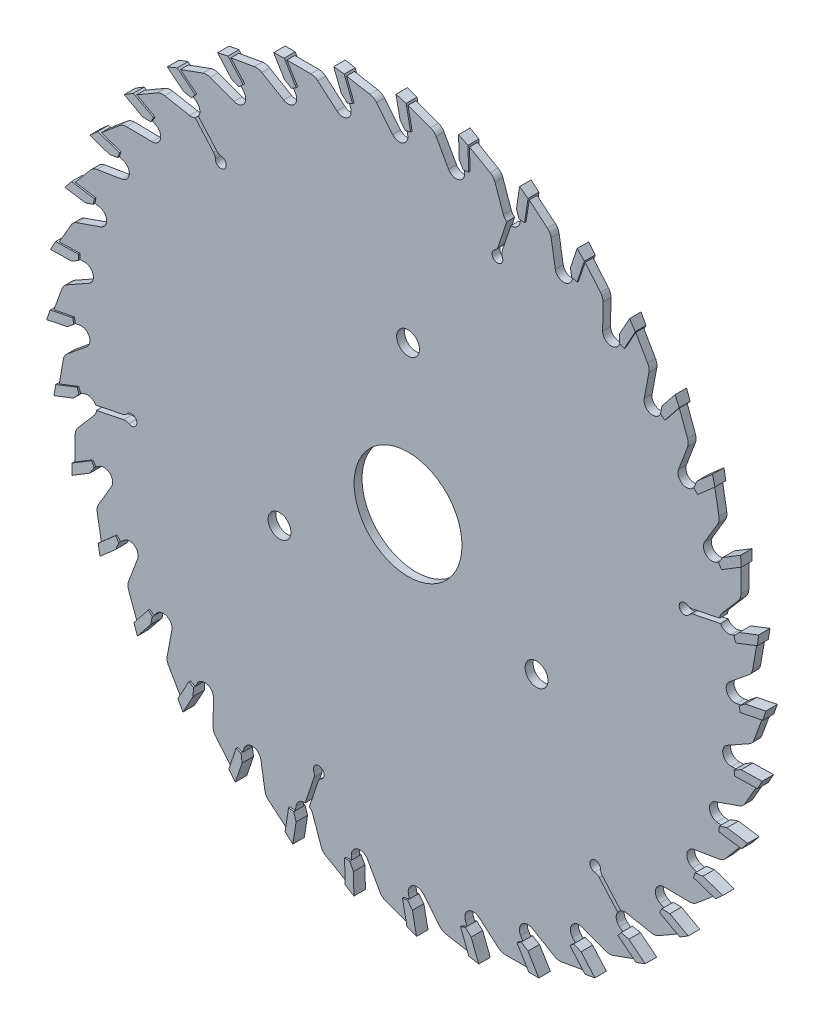
from build123d import *

# Parameters (mm, degrees)
SZKIC1_R                    = 98.5
SZKIC1_R_2                  = 15
DODANIE_WYCI_GNI_CIE1_DEPTH = 1.1
WYTNIJ_WYCI_GNI_CIE1_DEPTH  = 140.317407383
WYTNIJ_WYCI_GNI_CIE2_DEPTH  = 140.317407383
SZYK_KO_OWY2_COUNT          = 36
WYTNIJ_WYCI_GNI_CIE3_DEPTH  = 140.317407383
WYTNIJ_WYCI_GNI_CIE4_DEPTH  = 140.317407383
DODANIE_WYCI_GNI_CIE2_DEPTH = 1.6
WYTNIJ_WYCI_GNI_CIE6_DEPTH  = 15
SZYK_KO_OWY3_COUNT          = 36
WYTNIJ_WYCI_GNI_CIE5_DEPTH  = 142.447127931
SZYK_KO_OWY4_COUNT          = 6
CUT_EXTRUDE1_REACH          = 143.447
SKETCH1_R                   = 3.175


with BuildPart() as part:
    # Szkic1 → Dodanie-wyciągnięcie1 (new, symmetric)
    with BuildSketch(Plane.XY):
        Circle(SZKIC1_R)
        Circle(SZKIC1_R_2, mode=Mode.SUBTRACT)
    extrude(amount=DODANIE_WYCI_GNI_CIE1_DEPTH, both=True)

    # Szkic2 → Wytnij-wyciągnięcie1 (cut, through all)
    with BuildSketch(Plane.XY.offset(1.1)):
        with BuildLine():
            Line((0, 98.5), (1.136487637, 92.81243498))
            Line((1.136487637, 92.81243498), (-0.334434351, 92.518515764))
            Line((-0.334434351, 92.518515764), (-1.527286709, 98.488158655))
            ThreePointArc((-1.527286709, 98.488158655), (-0.763666306, 98.497039619), (0, 98.5))
        make_face()
    wytnij_wyci_gni_cie1 = extrude(amount=-WYTNIJ_WYCI_GNI_CIE1_DEPTH, mode=Mode.SUBTRACT)

    # Szkic3 → Wytnij-wyciągnięcie2 (cut, through all)
    with BuildSketch(Plane.XY.offset(1.1)):
        with BuildLine():
            Line((-1.527286709, 98.488158655), (-0.098383681, 91.337197557))
            ThreePointArc((-0.098383681, 91.337197557), (-1.426199989, 88.697128692), (-4.309075365, 89.346812717))
            Line((-4.309075365, 89.346812717), (-11.271301282, 97.85299059))
            ThreePointArc((-11.271301282, 97.85299059), (-6.407169676, 98.291394215), (-1.527286709, 98.488158655))
        make_face()
    wytnij_wyci_gni_cie2 = extrude(amount=-WYTNIJ_WYCI_GNI_CIE2_DEPTH, mode=Mode.SUBTRACT)

    # Szyk kołowy2: Wytnij-wyciągnięcie1, Wytnij-wyciągnięcie2 ×36 about axis
    szyk_ko_owy2_axis = Axis((0, 0, 14.502445444), (0, 0, -1))
    add([wytnij_wyci_gni_cie1.rotate(szyk_ko_owy2_axis, i * 360 / SZYK_KO_OWY2_COUNT) for i in range(1, SZYK_KO_OWY2_COUNT)], mode=Mode.SUBTRACT)
    add([wytnij_wyci_gni_cie2.rotate(szyk_ko_owy2_axis, i * 360 / SZYK_KO_OWY2_COUNT) for i in range(1, SZYK_KO_OWY2_COUNT)], mode=Mode.SUBTRACT)

    # Szkic4 → Wytnij-wyciągnięcie3 (cut, through all)
    with BuildSketch(Plane.XY.offset(1.1)):
        Polygon((-17.1043455, 97.003563672), (-11.399402036, 98.009499128), (-9.474966457, 95.6582983), align=None)
    wytnij_wyci_gni_cie3 = extrude(amount=-WYTNIJ_WYCI_GNI_CIE3_DEPTH, mode=Mode.SUBTRACT)

    # Szkic5 → Wytnij-wyciągnięcie4 (cut, through all)
    with BuildSketch(Plane.XY.offset(1.1)):
        with BuildLine():
            Line((-10.570772762, 95.851518518), (-9.474966457, 95.6582983))
            Line((-9.474966457, 95.6582983), (-8.770196666, 94.797237876))
            ThreePointArc((-8.770196666, 94.797237876), (-9.575874636, 95.485960074), (-10.570772762, 95.851518518))
        make_face()
    wytnij_wyci_gni_cie4 = extrude(amount=-WYTNIJ_WYCI_GNI_CIE4_DEPTH, mode=Mode.SUBTRACT)

    # Szkic7 → Dodanie-wyciągnięcie2 (add, symmetric)
    with BuildSketch(Plane.XY):
        Polygon((-0.118562575, 99.093347724), (1.136487637, 92.81243498), (-0.334434351, 92.518515764), (-1.706941298, 94.283798937), (-2.849150981, 100), align=None)
    dodanie_wyci_gni_cie2 = extrude(amount=DODANIE_WYCI_GNI_CIE2_DEPTH, both=True)

    # Szkic9 → Wytnij-wyciągnięcie6 (cut)
    with BuildSketch(Plane(origin=(-17.790057004, 89.030538173, 0), x_dir=(0.980614658546611, 0.19594614424252776, 0), z_dir=(0.19594614424252776, -0.980614658546611, 0))):
        Polygon((16.800695208, 1.6), (19.300695208, 1.512698076), (19.300695208, 1.6), align=None)
        Polygon((16.800695208, -1.6), (19.300695208, -1.6), (19.300695208, -1.512698076), align=None)
    wytnij_wyci_gni_cie6 = extrude(amount=-WYTNIJ_WYCI_GNI_CIE6_DEPTH, mode=Mode.SUBTRACT)

    # Szyk kołowy3: Wytnij-wyciągnięcie3, Wytnij-wyciągnięcie4, Dodanie-wyciągnięcie2, Wytnij-wyciągnięcie6 ×36 about axis
    szyk_ko_owy3_axis = Axis((0, 0, 14.502445444), (0, 0, -1))
    add([wytnij_wyci_gni_cie3.rotate(szyk_ko_owy3_axis, i * 360 / SZYK_KO_OWY3_COUNT) for i in range(1, SZYK_KO_OWY3_COUNT)], mode=Mode.SUBTRACT)
    add([wytnij_wyci_gni_cie4.rotate(szyk_ko_owy3_axis, i * 360 / SZYK_KO_OWY3_COUNT) for i in range(1, SZYK_KO_OWY3_COUNT)], mode=Mode.SUBTRACT)
    add([dodanie_wyci_gni_cie2.rotate(szyk_ko_owy3_axis, i * 360 / SZYK_KO_OWY3_COUNT) for i in range(1, SZYK_KO_OWY3_COUNT)])
    add([wytnij_wyci_gni_cie6.rotate(szyk_ko_owy3_axis, i * 360 / SZYK_KO_OWY3_COUNT) for i in range(1, SZYK_KO_OWY3_COUNT)], mode=Mode.SUBTRACT)

    # Szkic6 → Wytnij-wyciągnięcie5 (cut, through all)
    with BuildSketch(Plane.XY.offset(1.1)):
        with BuildLine():
            Line((-59.194248612, 65.894961172), (-58.296135347, 66.690820809))
            Line((-58.296135347, 66.690820809), (-53.167393606, 60.903128137))
            ThreePointArc((-53.167393606, 60.903128137), (-52.592240683, 60.454606088), (-51.894507567, 60.242141005))
            ThreePointArc((-51.894507567, 60.242141005), (-51.067660073, 57.628934527), (-53.562432203, 58.764115964))
            ThreePointArc((-53.562432203, 58.764115964), (-53.689425586, 59.48233988), (-54.065506871, 60.1072685))
            Line((-54.065506871, 60.1072685), (-59.194248612, 65.894961172))
        make_face()
    wytnij_wyci_gni_cie5 = extrude(amount=-WYTNIJ_WYCI_GNI_CIE5_DEPTH, mode=Mode.SUBTRACT)

    # Szyk kołowy4: Wytnij-wyciągnięcie5 ×6 about axis
    szyk_ko_owy4_axis = Axis((0, 0, 14.502445444), (0, 0, -1))
    for i in range(1, SZYK_KO_OWY4_COUNT):
        add(wytnij_wyci_gni_cie5.rotate(szyk_ko_owy4_axis, i * 360 / SZYK_KO_OWY4_COUNT), mode=Mode.SUBTRACT)

    # Sketch1 → Cut-Extrude1 (cut, up to next)
    with BuildSketch(Plane.XY.offset(1.1), mode=Mode.PRIVATE) as cut_extrude1_sk1:
        with Locations((0, 41.275)):
            Circle(SKETCH1_R)
    cut_extrude1_tool1 = extrude(cut_extrude1_sk1.sketch, amount=-CUT_EXTRUDE1_REACH, mode=Mode.PRIVATE) & part.part
    # Sketch1 → Cut-Extrude1 (cut, up to next)
    with BuildSketch(Plane.XY.offset(1.1), mode=Mode.PRIVATE) as cut_extrude1_sk2:
        with Locations((35.745198541, -20.6375)):
            Circle(SKETCH1_R)
    cut_extrude1_tool2 = extrude(cut_extrude1_sk2.sketch, amount=-CUT_EXTRUDE1_REACH, mode=Mode.PRIVATE) & part.part
    # Sketch1 → Cut-Extrude1 (cut, up to next)
    with BuildSketch(Plane.XY.offset(1.1), mode=Mode.PRIVATE) as cut_extrude1_sk3:
        with Locations((-35.745198541, -20.6375)):
            Circle(SKETCH1_R)
    cut_extrude1_tool3 = extrude(cut_extrude1_sk3.sketch, amount=-CUT_EXTRUDE1_REACH, mode=Mode.PRIVATE) & part.part
    add(cut_extrude1_tool1.solids().sort_by_distance((0, 41.275, 1.1))[0], mode=Mode.SUBTRACT)
    add(cut_extrude1_tool2.solids().sort_by_distance((35.745199, -20.6375, 1.1))[0], mode=Mode.SUBTRACT)
    add(cut_extrude1_tool3.solids().sort_by_distance((-35.745199, -20.6375, 1.1))[0], mode=Mode.SUBTRACT)


solid = part.part
